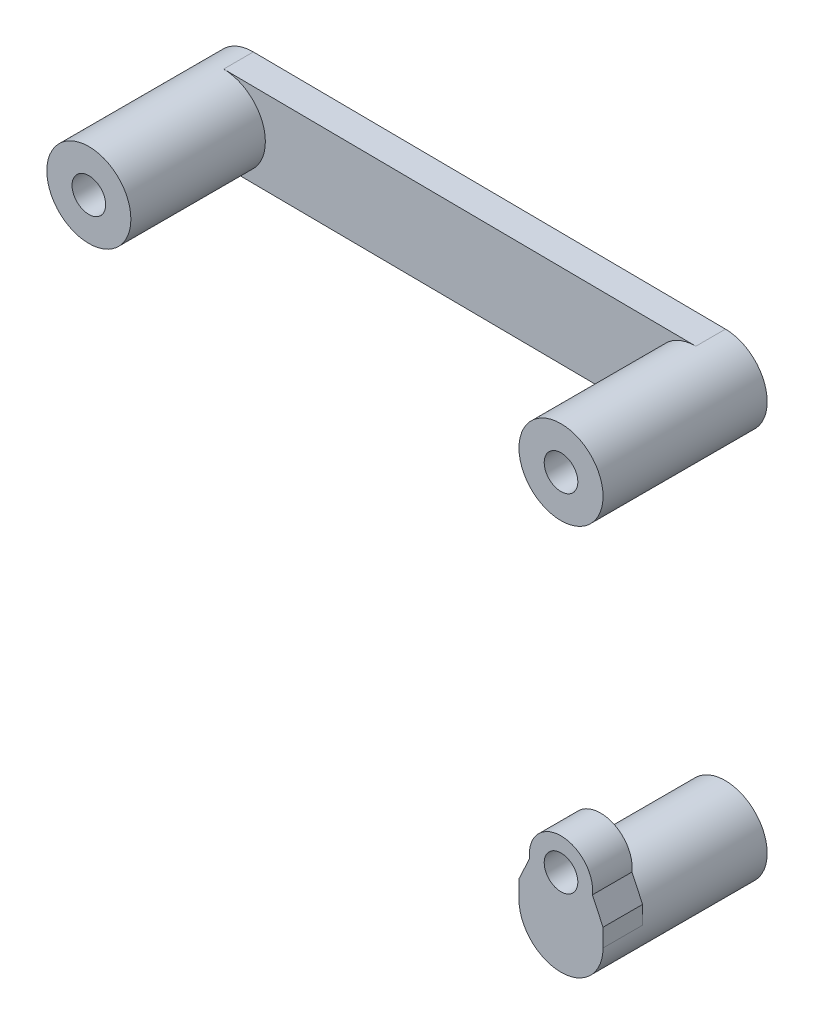
from build123d import *
from build123d.topology import SkipClean

# Parameters (mm, degrees)
SKIZZE1_R                         = 4.25
AUFSATZ_LINEAR_AUSTRAGEN1_DEPTH   = 16.6
AUFSATZ_LINEAR_AUSTRAGEN1_2_DEPTH = 16.6
AUFSATZ_LINEAR_AUSTRAGEN1_3_DEPTH = 16.6
SKIZZE2_R                         = 4.25
SCHNITT_LINEAR_AUSTRAGEN1_DEPTH   = 12.6
AUFSATZ_LINEAR_AUSTRAGEN2_DEPTH   = 4
SKIZZE4_R                         = 4.25
AUFSATZ_LINEAR_AUSTRAGEN3_DEPTH   = 16.6
AUFSATZ_LINEAR_AUSTRAGEN4_DEPTH   = 3
SKIZZE6_W                         = 8.5
SKIZZE6_H                         = 39.55
AUFSATZ_LINEAR_AUSTRAGEN5_DEPTH   = 3
AUFSATZ_LINEAR_AUSTRAGEN6_DEPTH   = 3
SKIZZE8_R                         = 1.7
SCHNITT_LINEAR_AUSTRAGEN2_DEPTH   = 4
SCHNITT_LINEAR_START              = -16.6
SKIZZE9_R                         = 2.1
SCHNITT_LINEAR_AUSTRAGEN3_DEPTH   = 5.7
SCHNITT_LINEAR_START_2            = -3
SCHNITT_LINEAR_AUSTRAGEN4_DEPTH   = 3
SCHNITT_LINEAR_AUSTRAGEN5_DEPTH   = 88.817835296
FASE1_SIZE                        = 2.680633651
FASE1_SIZE_2                      = 1.25


with BuildPart() as part:
    # Skizze1 → Aufsatz-Linear austragen1 (new body)
    with BuildSketch(Plane.XY):
        with Locations(Location((29.625, 16.383250172, 0), (0, 0, 90))):
            Circle(SKIZZE1_R)
    extrude(amount=AUFSATZ_LINEAR_AUSTRAGEN1_DEPTH)



with BuildPart() as body_2:
    # Skizze1 → Aufsatz-Linear austragen1 2 (new body)
    with BuildSketch(Plane.XY):
        with Locations(Location((77.375, 15.983250172, 0), (0, 0, 180))):
            Circle(SKIZZE1_R)
    extrude(amount=AUFSATZ_LINEAR_AUSTRAGEN1_2_DEPTH)


with BuildPart() as body_3:
    # Skizze1 → Aufsatz-Linear austragen1 3 (new body)
    with BuildSketch(Plane.XY):
        with Locations(Location((77.375, -19.066749828, 0), (0, 0, 90))):
            Circle(SKIZZE1_R)
    extrude(amount=AUFSATZ_LINEAR_AUSTRAGEN1_3_DEPTH)

    # Skizze2 → Schnitt-Linear austragen1 (cut)
    with BuildSketch(Plane.XY):
        with Locations(Location((77.375, -19.066749828, 0), (0, 0, 90))):
            Circle(SKIZZE2_R)
    extrude(amount=SCHNITT_LINEAR_AUSTRAGEN1_DEPTH, mode=Mode.SUBTRACT)

    # Skizze3 → Aufsatz-Linear austragen2 (add)
    with BuildSketch(Plane.XY.offset(16.6)):
        with BuildLine():
            Line((81.625, -19.066749828), (81.625, -23.566749828))
            ThreePointArc((81.625, -23.566749828), (77.375, -27.816749828), (73.125, -23.566749828))
            Line((73.125, -23.566749828), (73.125, -19.066749828))
            ThreePointArc((73.125, -19.066749828), (77.375, -14.816749828), (81.625, -19.066749828))
        make_face()
    extrude(amount=-AUFSATZ_LINEAR_AUSTRAGEN2_DEPTH)

    # Skizze4 → Aufsatz-Linear austragen3 (add)
    with BuildSketch(Plane.XY.offset(16.6)):
        with Locations((77.375, -23.566749828)):
            Circle(SKIZZE4_R)
    extrude(amount=-AUFSATZ_LINEAR_AUSTRAGEN3_DEPTH)


with BuildPart() as part_1:
    add(part.part)

    add(body_3.part)  # Aufsatz-Linear austragen4 merges body 3
    # Skizze5 → Aufsatz-Linear austragen4 (add)
    with BuildSketch(Plane.XY):
        Polygon((26.897842702, 13.123631624), (74.647842702, -26.826368376), (80.102157298, -20.307131281), (32.352157298, 19.642868719), align=None)
    extrude(amount=AUFSATZ_LINEAR_AUSTRAGEN4_DEPTH)


    add(body_2.part)  # Aufsatz-Linear austragen5 merges body 2
    # Skizze6 → Aufsatz-Linear austragen5 (add)
    with BuildSketch(Plane(origin=(0, 0, 0), x_dir=(-1, 0, 0), z_dir=(0, 0, -1))):
        with Locations((-77.375, -3.791749828)):
            Rectangle(SKIZZE6_W, SKIZZE6_H)
    extrude(amount=-AUFSATZ_LINEAR_AUSTRAGEN5_DEPTH)

    # Skizze7 → Aufsatz-Linear austragen6 (add)
    with BuildSketch(Plane(origin=(0, 0, 0), x_dir=(-1, 0, 0), z_dir=(0, 0, -1))):
        Polygon((-77.410600845, 20.233101061), (-29.660600845, 20.633101061), (-29.589399155, 12.133399283), (-77.339399155, 11.733399283), align=None)
    extrude(amount=-AUFSATZ_LINEAR_AUSTRAGEN6_DEPTH)

    # Skizze8 → Schnitt-Linear austragen2 (cut)
    with BuildSketch(Plane.XY.offset(16.6)):
        with Locations((29.625, 16.383250172)):
            Circle(SKIZZE8_R)
        with Locations(Location((77.375, -19.066749828, 0), (0, 0, 340.618124407))):
            Circle(SKIZZE8_R)
        with Locations(Location((77.375, 15.983250172, 0), (0, 0, 180))):
            Circle(SKIZZE8_R)
    extrude(amount=-SCHNITT_LINEAR_AUSTRAGEN2_DEPTH, mode=Mode.SUBTRACT)

    # Skizze9 → Schnitt-Linear austragen3 (cut)
    with BuildSketch(Plane.XY.offset(16.6).offset(SCHNITT_LINEAR_START)):
        with Locations(Location((29.625, 16.383250172, 0), (0, 0, 180))):
            Circle(SKIZZE9_R)
        with Locations(Location((77.375, -23.566749828, 0), (0, 0, 180))):
            Circle(SKIZZE9_R)
        with Locations(Location((77.375, 15.983250172, 0), (0, 0, 180))):
            Circle(SKIZZE9_R)
    extrude(amount=SCHNITT_LINEAR_AUSTRAGEN3_DEPTH, mode=Mode.SUBTRACT)

    # Skizze11 → Schnitt-Linear austragen4 (cut)
    with SkipClean():  # the faces are left unmerged after this step: merging them gives an invalid solid
        with BuildSketch(Plane.XY.offset(3).offset(SCHNITT_LINEAR_START_2)):
            with BuildLine():
                Line((26.897842702, 13.123631624), (74.647842702, -26.826368376))
                ThreePointArc((74.647842702, -26.826368376), (75.57610013, -19.716235673), (81.625, -23.566749828))
                Line((81.625, -23.566749828), (81.625, 15.983250172))
                ThreePointArc((81.625, 15.983250172), (80.367590551, 12.965485801), (77.339399155, 11.733399283))
                Line((77.339399155, 11.733399283), (29.589399155, 12.133399283))
                ThreePointArc((29.589399155, 12.133399283), (28.157570901, 12.394622358), (26.897842702, 13.123631624))
            make_face()
        extrude(amount=SCHNITT_LINEAR_AUSTRAGEN4_DEPTH, mode=Mode.SUBTRACT)


with BuildPart() as schnitt_linear_austragen4_piece_1:
    # of the separate pieces the step leaves, piece 1, a body of its own (schnitt_linear_austragen4_pieces)
    add(part_1.part.solids().sort_by_distance((41.446525663, 12.034072568, 3))[0])


with BuildPart() as schnitt_linear_austragen4_piece_2:
    # of the separate pieces the step leaves, piece 2, a body of its own (schnitt_linear_austragen4_pieces)
    add(part_1.part.solids().sort_by_distance((73.125, -19.066749828, 16.6))[0])

    # Skizze12 → Schnitt-Linear austragen5 (cut, through all)
    with SkipClean():  # the faces are left unmerged after this step: merging them gives an invalid solid
        with BuildSketch(Plane.XY.offset(16.6)):
            with BuildLine():
                Line((73.125, -19.066749828), (74.175, -19.066749828))
                ThreePointArc((74.175, -19.066749828), (77.375, -15.866749828), (80.575, -19.066749828))
                Line((80.575, -19.066749828), (81.625, -19.066749828))
                ThreePointArc((81.625, -19.066749828), (77.375, -14.816749828), (73.125, -19.066749828))
            make_face()
        extrude(amount=-SCHNITT_LINEAR_AUSTRAGEN5_DEPTH, mode=Mode.SUBTRACT)

    # Fase1
    # the kernel refuses this chamfer: 2.680633651, 1.25 mm, written as the material it takes off along each edge
    with BuildSketch(Plane(origin=(73.125, -19.066749828, 23.545456037), x_dir=(-0.016311164131098583, -0.9998669641130706, 0), z_dir=(0, 0, -1))) as fase1_piece_1_section:
        Polygon((FASE1_SIZE * 0.999866963978, -FASE1_SIZE * 0.0163111641289), (-FASE1_SIZE_2 * 0.0163111641311, -FASE1_SIZE_2 * 0.999866964113), (0, 0), align=None)
    fase1_piece_1 = extrude(amount=17.890912073, mode=Mode.PRIVATE)
    fase1_piece_1 = fase1_piece_1 - Plane(origin=(77.375, -19.066749828, 14.6), x_dir=(-1, 0, 0), z_dir=(0, 0, 1)) * Cylinder(3.2, 47, mode=Mode.PRIVATE)
    add(fase1_piece_1, mode=Mode.SUBTRACT)
    with BuildSketch(Plane(origin=(81.625, -19.066749828, 23.545456037), x_dir=(0.01631116413110359, -0.9998669641130705, 0), z_dir=(0, 0, -1))) as fase1_piece_2_section:
        Polygon((FASE1_SIZE * 0.999866963978, FASE1_SIZE * 0.0163111641289), (-FASE1_SIZE_2 * 0.0163111641311, FASE1_SIZE_2 * 0.999866964113), (0, 0), align=None)
    fase1_piece_2 = extrude(amount=17.890912073, mode=Mode.PRIVATE)
    fase1_piece_2 = fase1_piece_2 - Plane(origin=(77.375, -19.066749828, 14.6), x_dir=(-1, 0, 0), z_dir=(0, 0, 1)) * Cylinder(3.2, 47, mode=Mode.PRIVATE)
    add(fase1_piece_2, mode=Mode.SUBTRACT)


solid = Compound([schnitt_linear_austragen4_piece_1.part, schnitt_linear_austragen4_piece_2.part])
